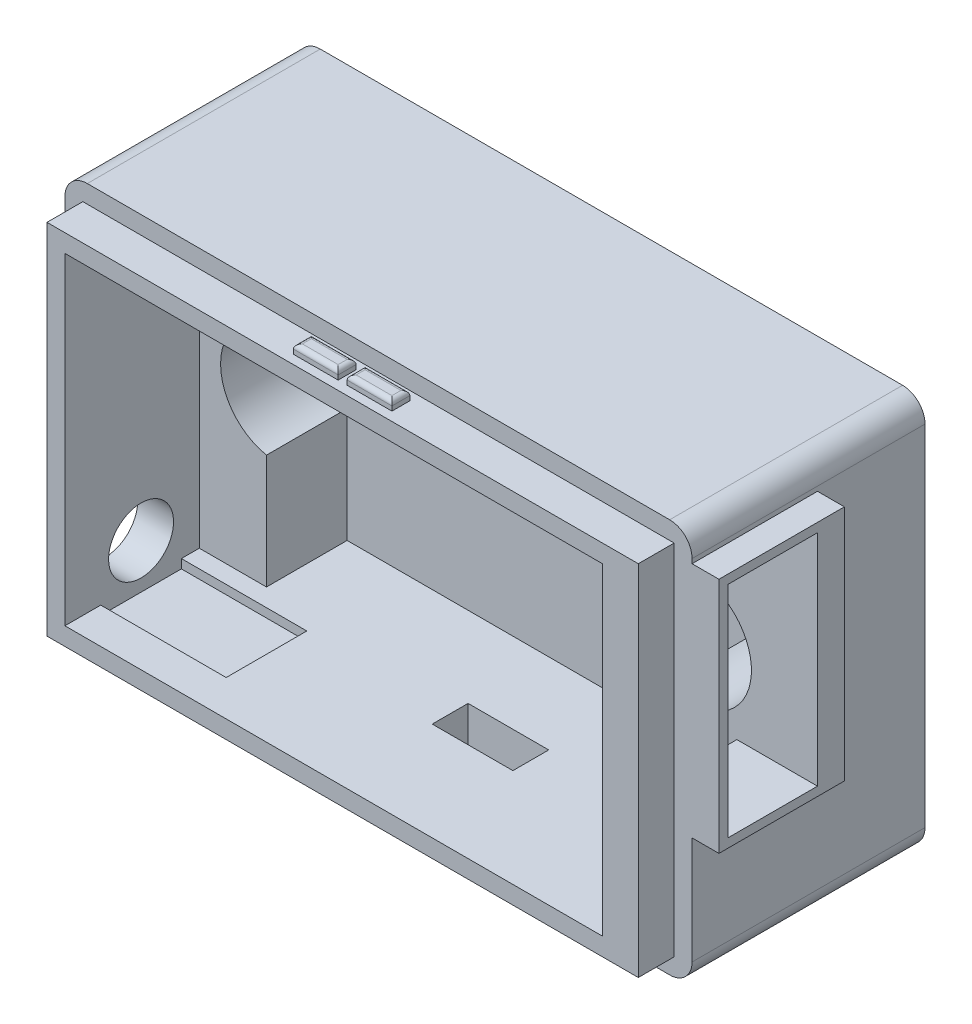
from build123d import *

# Parameters (mm, degrees)
SKETCH1_W                   = 70
SKETCH1_H                   = 44
MIAN_BOSS_EXTRUDE_DEPTH     = 30
SKETCH2_W                   = 60
SKETCH2_H                   = 36
MAIN_CUT_DEPTH              = 15
SKETCH4_W                   = 45
SKETCH4_H                   = 35
BATTERY_CUT_DEPTH           = 9
SKETCH5_R                   = 6.375
ELCTRODE_CUT_DEPTH          = 18
SKETCH6_W                   = 10
SKETCH6_H                   = 24.5
USB_C_CUT_DEPTH             = 7
SKETCH7_R                   = 3.625
BUTTON_CUT_DEPTH            = 7
SKETCH8_W                   = 9
SKETCH8_H                   = 4
SWITCH_CUT_DEPTH            = 7
OUTSIDE_FILLET_R            = 2.5
SKETCH10_OUTSIDE_W          = 89.59
SKETCH10_OUTSIDE_H          = 63.59
SKETCH10_OUTSIDE_W_2        = 66
SKETCH10_OUTSIDE_H_2        = 40
OUTER_LID_EXTRUDE_DEPTH     = 4
LID_SNAP_EXTRUDE_DEPTH      = 1
LID_SNAP_EXTRUDE_DEPTH_BACK = 41
SKETCH11_W                  = 5
SKETCH11_H                  = 2
SKETCH13_W                  = 11
SKETCH13_H                  = 36
INNER_LID_EXTRUDE_DEPTH     = 3
SKETCH14_W                  = 14
SKETCH14_H                  = 26.5
SKETCH14_W_2                = 10
SKETCH14_H_2                = 24.5
USB_COVER_EXTRUDE_DEPTH     = 3
SKETCH15_W                  = 4
SKETCH15_H                  = 9
BUTTON_SIDE_CUT_DEPTH       = 1
CHAMFER1_SIZE               = 10
LID_SNAP_FILLET_R           = 0.5


with BuildPart() as part:
    # Sketch1 → Mian Boss Extrude (new body)
    with BuildSketch(Plane.XY):
        with Locations((35, 22)):
            Rectangle(SKETCH1_W, SKETCH1_H)
    extrude(amount=MIAN_BOSS_EXTRUDE_DEPTH)

    # Sketch2 → Main cut (cut)
    with BuildSketch(Plane.XY.offset(30)):
        with Locations((34, 22)):
            Rectangle(SKETCH2_W, SKETCH2_H)
    extrude(amount=-MAIN_CUT_DEPTH, mode=Mode.SUBTRACT)

    # Sketch4 → Battery Cut (cut)
    with BuildSketch(Plane.XY.offset(15)):
        with Locations((34, 21.5)):
            Rectangle(SKETCH4_W, SKETCH4_H)
    extrude(amount=-BATTERY_CUT_DEPTH, mode=Mode.SUBTRACT)

    # Sketch5 → Elctrode Cut (cut)
    with BuildSketch(Plane(origin=(0, 0, 0), x_dir=(-1, 0, 0), z_dir=(0, 0, -1))):
        with Locations((-59.25, 23)):
            Circle(SKETCH5_R)
        with Locations((-12.75, 23)):
            Circle(SKETCH5_R)
    extrude(amount=-ELCTRODE_CUT_DEPTH, mode=Mode.SUBTRACT)

    # Sketch6 → USB-c Cut (cut)
    with BuildSketch(Plane(origin=(70, 0, 0), x_dir=(0, 0, -1), z_dir=(1, 0, 0))):
        with Locations((-20, 27.75)):
            Rectangle(SKETCH6_W, SKETCH6_H)
    extrude(amount=-USB_C_CUT_DEPTH, mode=Mode.SUBTRACT)

    # Sketch7 → Button Cut (cut)
    with BuildSketch(Plane.ZY):
        with Locations((21.5, 8)):
            Circle(SKETCH7_R)
    extrude(amount=-BUTTON_CUT_DEPTH, mode=Mode.SUBTRACT)

    # Sketch8 → Switch Cut (cut)
    with BuildSketch(Plane.XZ):
        with Locations((38.5, 17)):
            Rectangle(SKETCH8_W, SKETCH8_H)
    extrude(amount=-SWITCH_CUT_DEPTH, mode=Mode.SUBTRACT)

    # Outside Fillet
    outside_fillet_edges = [part.edges().sort_by_distance(p)[0] for p in [
        (0, 44, 15),
        (70, 44, 15),
        (70, 0, 15),
        (0, 0, 15),
    ]]
    fillet(outside_fillet_edges, radius=OUTSIDE_FILLET_R)

    # Sketch10 outside → Outer lid Extrude (cut)
    with BuildSketch(Plane.XY.offset(30)):
        with Locations((35, 22)):
            Rectangle(SKETCH10_OUTSIDE_W, SKETCH10_OUTSIDE_H)
        with Locations((35, 22)):
            Rectangle(SKETCH10_OUTSIDE_W_2, SKETCH10_OUTSIDE_H_2, mode=Mode.SUBTRACT)
    extrude(amount=-OUTER_LID_EXTRUDE_DEPTH, mode=Mode.SUBTRACT)

    # Sketch11 → Lid Snap-Extrude (add, two sides: drawn at the far end of the back side and taken through both)
    with BuildSketch(Plane.XZ.offset(-2).offset(-LID_SNAP_EXTRUDE_DEPTH_BACK)):
        with Locations((31, 28)):
            Rectangle(SKETCH11_W, SKETCH11_H)
        with Locations((37, 28)):
            Rectangle(SKETCH11_W, SKETCH11_H)
    extrude(amount=LID_SNAP_EXTRUDE_DEPTH + LID_SNAP_EXTRUDE_DEPTH_BACK)

    # Sketch13 → Inner Lid-Extrude (cut)
    with BuildSketch(Plane.XY.offset(29)):
        with Locations((34, 22)):
            Rectangle(SKETCH13_W, SKETCH13_H)
    extrude(amount=-INNER_LID_EXTRUDE_DEPTH, mode=Mode.SUBTRACT)

    # Sketch14 → USB Cover-Extrude (add)
    with BuildSketch(Plane(origin=(70, 0, 0), x_dir=(0, 0, -1), z_dir=(1, 0, 0))):
        with Locations((-19, 27.75)):
            Rectangle(SKETCH14_W, SKETCH14_H)
        with Locations((-20, 27.75)):
            Rectangle(SKETCH14_W_2, SKETCH14_H_2, mode=Mode.SUBTRACT)
    extrude(amount=USB_COVER_EXTRUDE_DEPTH)

    # Sketch15 → Button side cut (cut)
    with BuildSketch(Plane(origin=(0, 4, 0), x_dir=(1, 0, 0), z_dir=(0, 1, 0))):
        with Locations((6, -21.5)):
            Rectangle(SKETCH15_W, SKETCH15_H)
    extrude(amount=-BUTTON_SIDE_CUT_DEPTH, mode=Mode.SUBTRACT)

    # Chamfer1
    # the kernel refuses this chamfer: 10 mm, written as the material it takes off along each edge
    with BuildSketch(Plane(origin=(8, 4, 17), x_dir=(0.9996219169112968, 0.027495876610586403, 0), z_dir=(0, 0, 1))) as chamfer1_piece_1_section:
        Polygon((CHAMFER1_SIZE * 0.999621916911, -CHAMFER1_SIZE * 0.0274958766106), (-CHAMFER1_SIZE * 0.0274958766106, -CHAMFER1_SIZE * 0.999621916911), (0, 0), align=None)
    chamfer1_piece_1 = extrude(amount=9, mode=Mode.PRIVATE)
    chamfer1_piece_1 = split(chamfer1_piece_1, bisect_by=Plane(origin=(14.506944444, 3, 21.5), z_dir=(0, 1, 0)), keep=Keep.TOP, mode=Mode.PRIVATE)
    add(chamfer1_piece_1, mode=Mode.SUBTRACT)

    # Lid Snap Fillet
    lid_snap_fillet_edges = [part.edges().sort_by_distance(p)[0] for p in [
        (28.5, 43, 28),
        (31, 43, 29),
        (33.5, 43, 28),
        (31, 43, 27),
        (28.5, 1, 28),
        (31, 1, 27),
        (33.5, 1, 28),
        (31, 1, 29),
        (37, 43, 29),
        (39.5, 43, 28),
        (37, 43, 27),
        (34.5, 43, 28),
        (37, 1, 29),
        (34.5, 1, 28),
        (37, 1, 27),
        (39.5, 1, 28),
    ]]
    fillet(lid_snap_fillet_edges, radius=LID_SNAP_FILLET_R)


solid = part.part
